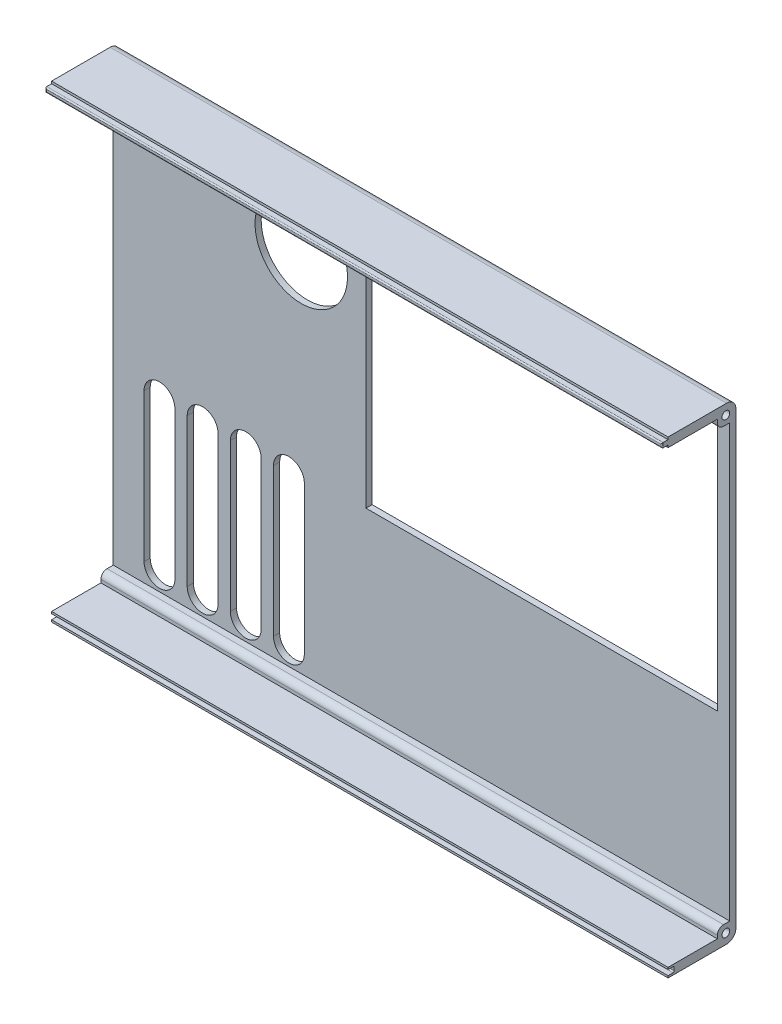
from build123d import *

# Parameters (mm, degrees)
SKETCH1_W                = 200
SKETCH1_H                = 152
BODY_DEPTH               = 2
SKETCH3_R                = 15
FAN_EXHAUST_GRILL_DEPTH  = 139.567397543
SKETCH12_W               = 200
SKETCH12_H               = 6
SIDE_WALLS_DEPTH         = 20
MOUNT_HOLES_L_DEPTH      = 221.580877825
MOUNT_HOLES_L_DEPTH_BACK = 10
SKETCH14_R               = 1.25
MOUNT_HOLES_R_START      = -10
SKETCH16_R               = 1.25
MOUNT_HOLES_R_DEPTH      = 10
SKETCH18_W               = 16
SKETCH18_H               = 3
WALL_REDUCE_DEPTH        = 221.580877825
SKETCH19_W               = 200
SKETCH19_H               = 1.7
GROOVE_DEPTH             = 2
SKETCH20_W               = 200
SKETCH20_H               = 1.5
NOTCH_DEPTH              = 2
SKETCH21_W               = 114
SKETCH21_H               = 82
BATT_CUT_DEPTH           = 141.288715376
FILLET1_R                = 3
FILLET2_R                = 2
FILLET3_R                = 0.4


with BuildPart() as part:
    # Sketch1 → body (new body)
    with BuildSketch(Plane.XY):
        with Locations((5, -14.39869281)):
            Rectangle(SKETCH1_W, SKETCH1_H)
    extrude(amount=BODY_DEPTH)

    # Sketch3 → fan_exhaust_grill (cut, through all)
    with BuildSketch(Plane(origin=(0, 0, 0), x_dir=(-1, 0, 0), z_dir=(0, 0, -1))):
        with Locations((34, 34.60130719)):
            Circle(SKETCH3_R)
        with BuildLine():
            Line((61, -78.39869281), (61, -30.39869281))
            ThreePointArc((61, -30.39869281), (66, -25.39869281), (71, -30.39869281))
            Line((71, -30.39869281), (71, -78.39869281))
            ThreePointArc((71, -78.39869281), (66, -83.39869281), (61, -78.39869281))
        make_face()
        with BuildLine():
            Line((75, -78.39869281), (75, -30.39869281))
            ThreePointArc((75, -30.39869281), (80, -25.39869281), (85, -30.39869281))
            Line((85, -30.39869281), (85, -78.39869281))
            ThreePointArc((85, -78.39869281), (80, -83.39869281), (75, -78.39869281))
        make_face()
        with BuildLine():
            Line((47, -78.39869281), (47, -30.39869281))
            ThreePointArc((47, -30.39869281), (52, -25.39869281), (57, -30.39869281))
            Line((57, -30.39869281), (57, -78.39869281))
            ThreePointArc((57, -78.39869281), (52, -83.39869281), (47, -78.39869281))
        make_face()
        with BuildLine():
            Line((33, -78.39869281), (33, -30.39869281))
            ThreePointArc((33, -30.39869281), (38, -25.39869281), (43, -30.39869281))
            Line((43, -30.39869281), (43, -78.39869281))
            ThreePointArc((43, -78.39869281), (38, -83.39869281), (33, -78.39869281))
        make_face()
    extrude(amount=-FAN_EXHAUST_GRILL_DEPTH, mode=Mode.SUBTRACT)

    # Sketch12 → side_walls (add)
    with BuildSketch(Plane.XY.offset(2)):
        with Locations((5, -87.39869281)):
            Rectangle(SKETCH12_W, SKETCH12_H)
        with Locations((5, 58.60130719)):
            Rectangle(SKETCH12_W, SKETCH12_H)
    extrude(amount=SIDE_WALLS_DEPTH)

    # Sketch14 → mount_holes_l (cut, two sides: drawn at the far end of the back side and taken through both)
    with BuildSketch(Plane(origin=(105, 0, 0), x_dir=(0, 0, -1), z_dir=(1, 0, 0)).offset(-MOUNT_HOLES_L_DEPTH_BACK)):
        with Locations((-3.25, -87.14869281)):
            Circle(SKETCH14_R)
        with Locations((-3.25, 58.35130719)):
            Circle(SKETCH14_R)
    extrude(amount=MOUNT_HOLES_L_DEPTH + MOUNT_HOLES_L_DEPTH_BACK, mode=Mode.SUBTRACT)

    # Sketch16 → mount_holes_r (cut)
    with BuildSketch(Plane.ZY.offset(95).offset(MOUNT_HOLES_R_START)):
        with Locations((3.25, -87.14869281)):
            Circle(SKETCH16_R)
        with Locations((3.25, 58.35130719)):
            Circle(SKETCH16_R)
    extrude(amount=MOUNT_HOLES_R_DEPTH, mode=Mode.SUBTRACT)

    # Sketch18 → wall_reduce (cut, through all)
    with BuildSketch(Plane(origin=(105, 0, 0), x_dir=(0, 0, -1), z_dir=(1, 0, 0))):
        with Locations((-14, -85.89869281)):
            Rectangle(SKETCH18_W, SKETCH18_H)
        with Locations((-14, 57.10130719)):
            Rectangle(SKETCH18_W, SKETCH18_H)
    extrude(amount=-WALL_REDUCE_DEPTH, mode=Mode.SUBTRACT)

    # Sketch19 → groove (cut)
    with BuildSketch(Plane.XY.offset(22)):
        with Locations((5, -88.89869281)):
            Rectangle(SKETCH19_W, SKETCH19_H)
    extrude(amount=-GROOVE_DEPTH, mode=Mode.SUBTRACT)

    # Sketch20 → notch (add)
    with BuildSketch(Plane.XY.offset(22)):
        with Locations((5, 60.10130719)):
            Rectangle(SKETCH20_W, SKETCH20_H)
    extrude(amount=NOTCH_DEPTH)

    # Sketch21 → batt_cut (cut, through all)
    with BuildSketch(Plane.XY.offset(2)):
        with Locations((44, 13.60130719)):
            Rectangle(SKETCH21_W, SKETCH21_H)
    extrude(amount=-BATT_CUT_DEPTH, mode=Mode.SUBTRACT)

    # Fillet1
    fillet1_edges = [part.edges().sort_by_distance(p)[0] for p in [
        (5, -90.39869281, 0),
        (5, 61.60130719, 0),
    ]]
    fillet(fillet1_edges, radius=FILLET1_R)

    # Fillet2
    fillet2_edges = [part.edges().sort_by_distance(p)[0] for p in [
        (5, -84.39869281, 6),
        (5, 55.60130719, 6),
    ]]
    fillet(fillet2_edges, radius=FILLET2_R)

    # Fillet3
    fillet3_edges = [part.edges().sort_by_distance(p)[0] for p in [
        (5, 60.85130719, 24),
        (105, 60.10130719, 24),
        (5, 59.35130719, 24),
        (-95, 60.10130719, 24),
        (5, -89.74869281, 20),
        (5, -88.04869281, 20),
    ]]
    fillet(fillet3_edges, radius=FILLET3_R)


solid = part.part
